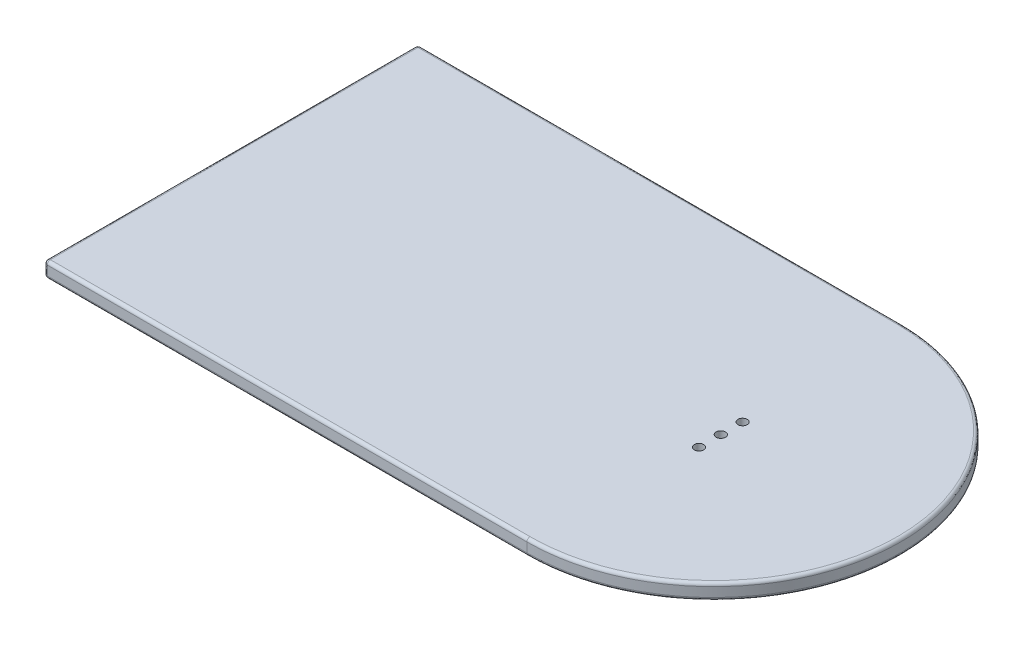
from build123d import *

# Parameters (mm, degrees)
BOSS_EXTRUDE2_DEPTH   = 5
FILLET1_R             = 1
F_3_0MM_DOWEL_HOLE2_D = 3


with BuildPart() as part:
    # Sketch1 → Boss-Extrude2 (new body)
    with BuildSketch(Plane(origin=(0, 0, 0), x_dir=(1, 0, 0), z_dir=(0, 1, 0))):
        with BuildLine():
            Line((-77.5, -60), (77.5, -60))
            ThreePointArc((77.5, -60), (137.5, 0), (77.5, 60))
            Line((77.5, 60), (-77.5, 60))
            Line((-77.5, 60), (-77.5, -60))
        make_face()
    extrude(amount=BOSS_EXTRUDE2_DEPTH)

    # Fillet1
    fillet1_edges = [part.edges().sort_by_distance(p)[0] for p in [
        (-77.5, 2.5, -60),
        (-77.5, 2.5, 60),
        (-77.5, 0, 0),
        (0, 0, -60),
        (137.5, 0, 0),
        (0, 0, 60),
        (-77.5, 5, 0),
        (0, 5, -60),
        (137.5, 5, 0),
        (0, 5, 60),
    ]]
    fillet(fillet1_edges, radius=FILLET1_R)

    # Ø3.0mm Dowel Hole2 (through all)
    with Locations(Plane(origin=(0, 5, 0), x_dir=(1, 0, 0), z_dir=(0, 1, 0))):
        with Locations((79.765079084, 0), (79.765079084, -7), (79.765079084, 7)):
            Hole(F_3_0MM_DOWEL_HOLE2_D / 2)


solid = part.part
